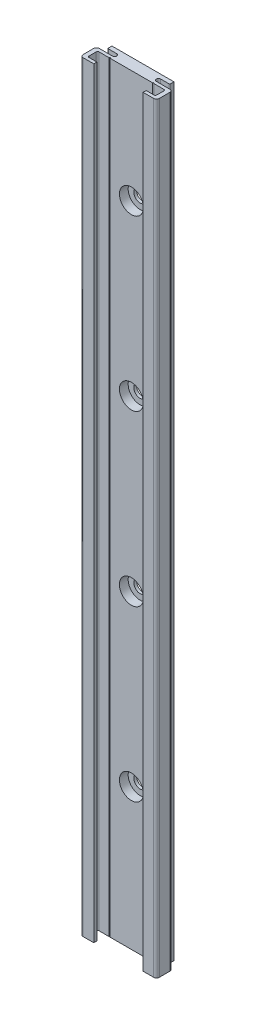
from build123d import *

# Parameters (mm, degrees)
BOSS_EXTRUDE1_DEPTH                              = 270
CUT_EXTRUDE1_DEPTH                               = 271.477244884
F_0_4_0_4_DIAMETER_HOLE1_D                       = 0.4
CBORE_FOR_M4_HEX_HEAD_MACHINE_SCREW1_D           = 4.5
CBORE_FOR_M4_HEX_HEAD_MACHINE_SCREW1_DEPTH       = 4.1
CBORE_FOR_M4_HEX_HEAD_MACHINE_SCREW1_CBORE_D     = 8.5
CBORE_FOR_M4_HEX_HEAD_MACHINE_SCREW1_CBORE_DEPTH = 3.1
FILLET1_R                                        = 0.2
FILLET2_R                                        = 0.5
FILLET3_R                                        = 1


with BuildPart() as part:
    # Sketch1 → Boss-Extrude1 (new body)
    with BuildSketch(Plane(origin=(0, 300, 0), x_dir=(1, 0, 0), z_dir=(0, 1, 0))):
        with BuildLine():
            Line((-13.5, -3), (-13.5, -8.7))
            Line((-13.5, -8.7), (13.5, -8.7))
            Line((13.5, -8.7), (13.5, -3))
            Line((13.5, -3), (7.8, -3))
            ThreePointArc((7.8, -3), (7.05, -2.25), (7.8, -1.5))
            Line((7.8, -1.5), (11, -1.5))
            Line((11, -1.5), (11, 0))
            Line((11, 0), (-11, 0))
            Line((-11, 0), (-11, -1.5))
            Line((-11, -1.5), (-7.8, -1.5))
            ThreePointArc((-7.8, -1.5), (-7.05, -2.25), (-7.8, -3))
            Line((-7.8, -3), (-13.5, -3))
        make_face()
    extrude(amount=-BOSS_EXTRUDE1_DEPTH)

    # Sketch2 → Cut-Extrude1 (cut, through all)
    with BuildSketch(Plane.XZ.offset(-30)):
        Polygon((8.75, 8.7), (-8.75, 8.7), (-8.75, 7.6), (-12, 7.6), (-12, 4.1), (12, 4.1), (12, 7.6), (8.75, 7.6), align=None)
    extrude(amount=-CUT_EXTRUDE1_DEPTH, mode=Mode.SUBTRACT)

    # Ø0.4 (0.4) Diameter Hole1 (through all)
    with Locations(Plane(origin=(0, 300, 0), x_dir=(1, 0, 0), z_dir=(0, 1, 0))):
        with Locations((-7.75, -4.1), (7.75, -4.1)):
            Hole(F_0_4_0_4_DIAMETER_HOLE1_D / 2)

    # CBORE for M4 Hex Head Machine Screw1
    with Locations(Plane.XY.offset(4.1)):
        with Locations((0, 260), (0, 200), (0, 140), (0, 80), (0, 20)):
            CounterBoreHole(CBORE_FOR_M4_HEX_HEAD_MACHINE_SCREW1_D / 2, CBORE_FOR_M4_HEX_HEAD_MACHINE_SCREW1_CBORE_D / 2, CBORE_FOR_M4_HEX_HEAD_MACHINE_SCREW1_CBORE_DEPTH, depth=CBORE_FOR_M4_HEX_HEAD_MACHINE_SCREW1_DEPTH)

    # Fillet1
    fillet1_edges = [part.edges().sort_by_distance(p)[0] for p in [
        (11, 165, 1.5),
        (-11, 165, 1.5),
    ]]
    fillet(fillet1_edges, radius=FILLET1_R)

    # Fillet2
    fillet2_edges = [part.edges().sort_by_distance(p)[0] for p in [
        (12, 165, 4.1),
        (-12, 165, 7.6),
        (12, 165, 7.6),
        (-12, 165, 4.1),
    ]]
    fillet(fillet2_edges, radius=FILLET2_R)

    # Fillet3
    fillet3_edges = [part.edges().sort_by_distance(p)[0] for p in [
        (-13.5, 165, 8.7),
        (-13.5, 165, 3),
        (13.5, 165, 3),
        (13.5, 165, 8.7),
    ]]
    fillet(fillet3_edges, radius=FILLET3_R)


solid = part.part
